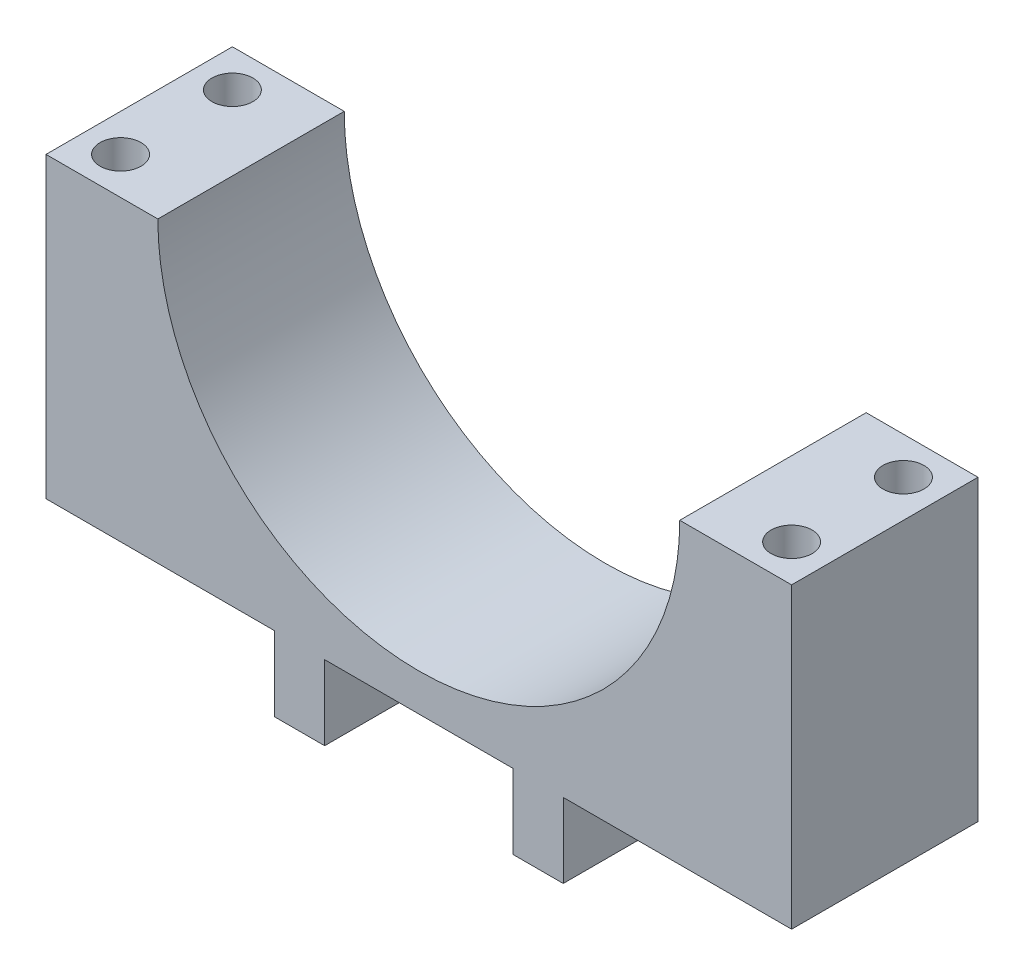
from build123d import *

# Parameters (mm, degrees)
DODANIE_WYCI_GNI_CIE1_DEPTH = 50
SZKIC2_R                    = 5.5
WYTNIJ_WYCI_GNI_CIE1_DEPTH  = 21


with BuildPart() as part:
    # Szkic1 → Dodanie-wyciągnięcie1 (new body)
    with BuildSketch(Plane.XY):
        with BuildLine():
            Line((70, 0), (100, 0))
            Line((100, 0), (100, -80))
            Line((100, -80), (38.75, -80))
            Line((38.75, -80), (38.75, -100))
            Line((38.75, -100), (25.25, -100))
            Line((25.25, -100), (25.25, -80))
            Line((25.25, -80), (-25.25, -80))
            Line((-25.25, -80), (-25.25, -100))
            Line((-25.25, -100), (-38.75, -100))
            Line((-38.75, -100), (-38.75, -80))
            Line((-38.75, -80), (-100, -80))
            Line((-100, -80), (-100, 0))
            Line((-100, 0), (-70, 0))
            ThreePointArc((-70, 0), (0, -70), (70, 0))
        make_face()
    extrude(amount=DODANIE_WYCI_GNI_CIE1_DEPTH)

    # Szkic2 → Wytnij-wyciągnięcie1 (cut)
    with BuildSketch(Plane(origin=(0, 0, 0), x_dir=(1, 0, 0), z_dir=(0, 1, 0))):
        with Locations((-90, -10)):
            Circle(SZKIC2_R)
        with Locations((-90, -40)):
            Circle(SZKIC2_R)
    wytnij_wyci_gni_cie1 = extrude(amount=-WYTNIJ_WYCI_GNI_CIE1_DEPTH, mode=Mode.SUBTRACT)

    # Lustro1: Wytnij-wyciągnięcie1 across plane
    add(wytnij_wyci_gni_cie1.mirror(Plane(origin=(0, 0, 0), x_dir=(0, 0, 1), z_dir=(1, 0, 0))), mode=Mode.SUBTRACT)


solid = part.part
